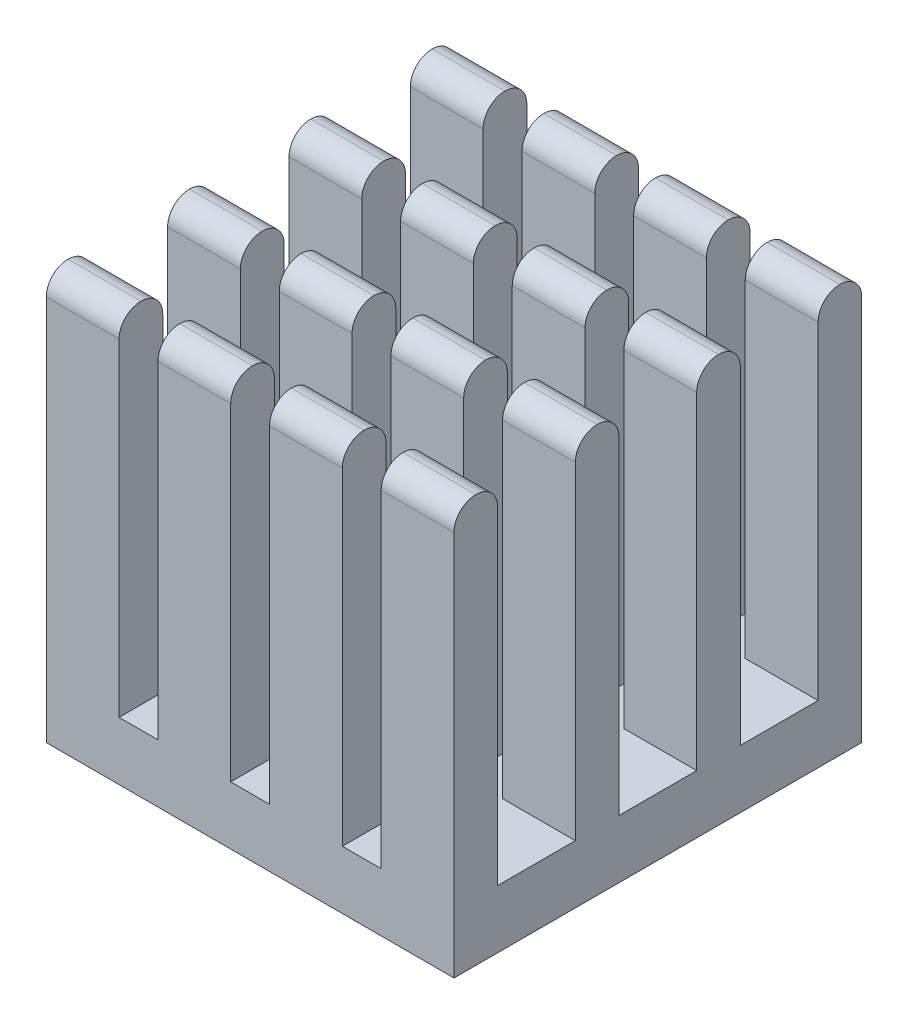
from build123d import *

# Parameters (mm, degrees)
SKETCH1_W           = 14
SKETCH1_H           = 14
BOSS_EXTRUDE1_DEPTH = 2
SKETCH2_W           = 2.5
SKETCH2_H           = 1.5
BOSS_EXTRUDE2_DEPTH = 12
FILLET1_R           = 0.75


with BuildPart() as part:
    # Sketch1 → Boss-Extrude1 (new body)
    with BuildSketch(Plane(origin=(0, 0, 0), x_dir=(1, 0, 0), z_dir=(0, 1, 0))):
        with Locations((7, 7)):
            Rectangle(SKETCH1_W, SKETCH1_H)
    extrude(amount=BOSS_EXTRUDE1_DEPTH)

    # Sketch2 → Boss-Extrude2 (add)
    with BuildSketch(Plane(origin=(0, 2, 0), x_dir=(1, 0, 0), z_dir=(0, 1, 0))):
        with Locations((5.083333333, 0.75)):
            Rectangle(SKETCH2_W, SKETCH2_H)
        with Locations((1.25, 0.75)):
            Rectangle(SKETCH2_W, SKETCH2_H)
        with Locations((8.916666667, 0.75)):
            Rectangle(SKETCH2_W, SKETCH2_H)
        with Locations((12.75, 0.75)):
            Rectangle(SKETCH2_W, SKETCH2_H)
        with Locations((5.083333333, 4.916666667)):
            Rectangle(SKETCH2_W, SKETCH2_H)
        with Locations((8.916666667, 4.916666667)):
            Rectangle(SKETCH2_W, SKETCH2_H)
        with Locations((12.75, 4.916666667)):
            Rectangle(SKETCH2_W, SKETCH2_H)
        with Locations((5.083333333, 9.083333333)):
            Rectangle(SKETCH2_W, SKETCH2_H)
        with Locations((8.916666667, 9.083333333)):
            Rectangle(SKETCH2_W, SKETCH2_H)
        with Locations((12.75, 9.083333333)):
            Rectangle(SKETCH2_W, SKETCH2_H)
        with Locations((5.083333333, 13.25)):
            Rectangle(SKETCH2_W, SKETCH2_H)
        with Locations((8.916666667, 13.25)):
            Rectangle(SKETCH2_W, SKETCH2_H)
        with Locations((12.75, 13.25)):
            Rectangle(SKETCH2_W, SKETCH2_H)
        with Locations((1.25, 4.916666667)):
            Rectangle(SKETCH2_W, SKETCH2_H)
        with Locations((1.25, 9.083333333)):
            Rectangle(SKETCH2_W, SKETCH2_H)
        with Locations((1.25, 13.25)):
            Rectangle(SKETCH2_W, SKETCH2_H)
    extrude(amount=BOSS_EXTRUDE2_DEPTH)

    # Fillet1
    fillet1_edges = [part.edges().sort_by_distance(p)[0] for p in [
        (12.75, 14, -12.5),
        (8.916666667, 14, -12.5),
        (5.083333333, 14, -12.5),
        (1.25, 14, -12.5),
        (1.25, 14, -14),
        (5.083333333, 14, -14),
        (8.916666667, 14, -14),
        (12.75, 14, -14),
        (12.75, 14, -9.833333333),
        (8.916666667, 14, -9.833333333),
        (5.083333333, 14, -9.833333333),
        (1.25, 14, -9.833333333),
        (1.25, 14, -8.333333333),
        (5.083333333, 14, -8.333333333),
        (8.916666667, 14, -8.333333333),
        (12.75, 14, -8.333333333),
        (8.916666667, 14, -5.666666667),
        (12.75, 14, -5.666666667),
        (5.083333333, 14, -5.666666667),
        (1.25, 14, -5.666666667),
        (1.25, 14, -4.166666667),
        (5.083333333, 14, -4.166666667),
        (8.916666667, 14, -4.166666667),
        (12.75, 14, -4.166666667),
        (8.916666667, 14, 0),
        (12.75, 14, 0),
        (12.75, 14, -1.5),
        (8.916666667, 14, -1.5),
        (5.083333333, 14, -1.5),
        (5.083333333, 14, 0),
        (1.25, 14, -1.5),
        (1.25, 14, 0),
    ]]
    fillet(fillet1_edges, radius=FILLET1_R - 0.0001)  # a hair under: the kernel refuses the full size


solid = part.part
